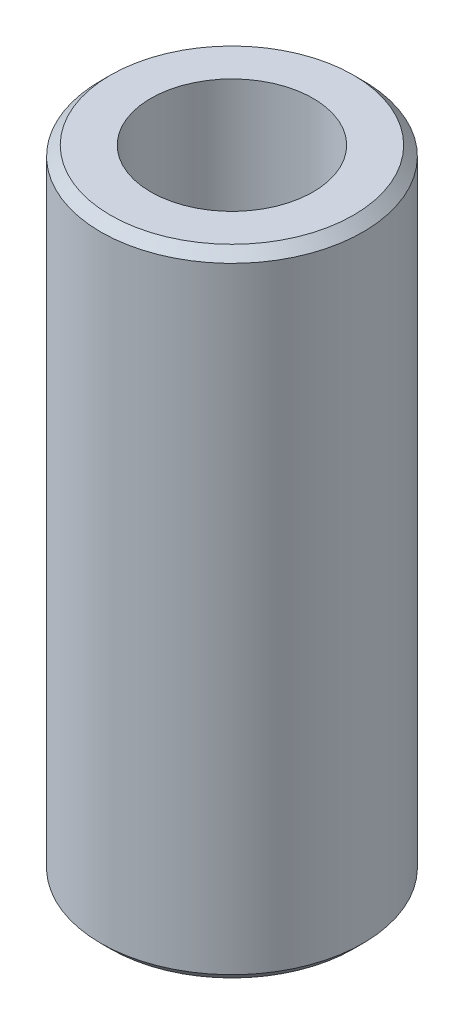
from build123d import *

# Parameters (mm, degrees)
SKETCH1_R           = 47.5
BOSS_EXTRUDE1_DEPTH = 230.184533354
SKETCH2_R           = 29.398157421
CUT_EXTRUDE1_DEPTH  = 240.786195173
CHAMFER1_SIZE       = 3.507417423


with BuildPart() as part:
    # Sketch1 → Boss-Extrude1 (new body)
    with BuildSketch(Plane(origin=(0, 0, 0), x_dir=(1, 0, 0), z_dir=(0, 1, 0))):
        Circle(SKETCH1_R)
    extrude(amount=BOSS_EXTRUDE1_DEPTH)

    # Sketch2 → Cut-Extrude1 (cut, through all)
    with BuildSketch(Plane(origin=(0, 0, 0), x_dir=(1, 0, 0), z_dir=(0, 1, 0))):
        Circle(SKETCH2_R)
    extrude(amount=CUT_EXTRUDE1_DEPTH, mode=Mode.SUBTRACT)

    # Chamfer1
    chamfer1_edges = [part.edges().sort_by_distance(p)[0] for p in [
        (-47.5, 230.184533354, 0),
        (-47.5, 0, 0),
    ]]
    chamfer(chamfer1_edges, length=CHAMFER1_SIZE)


solid = part.part
